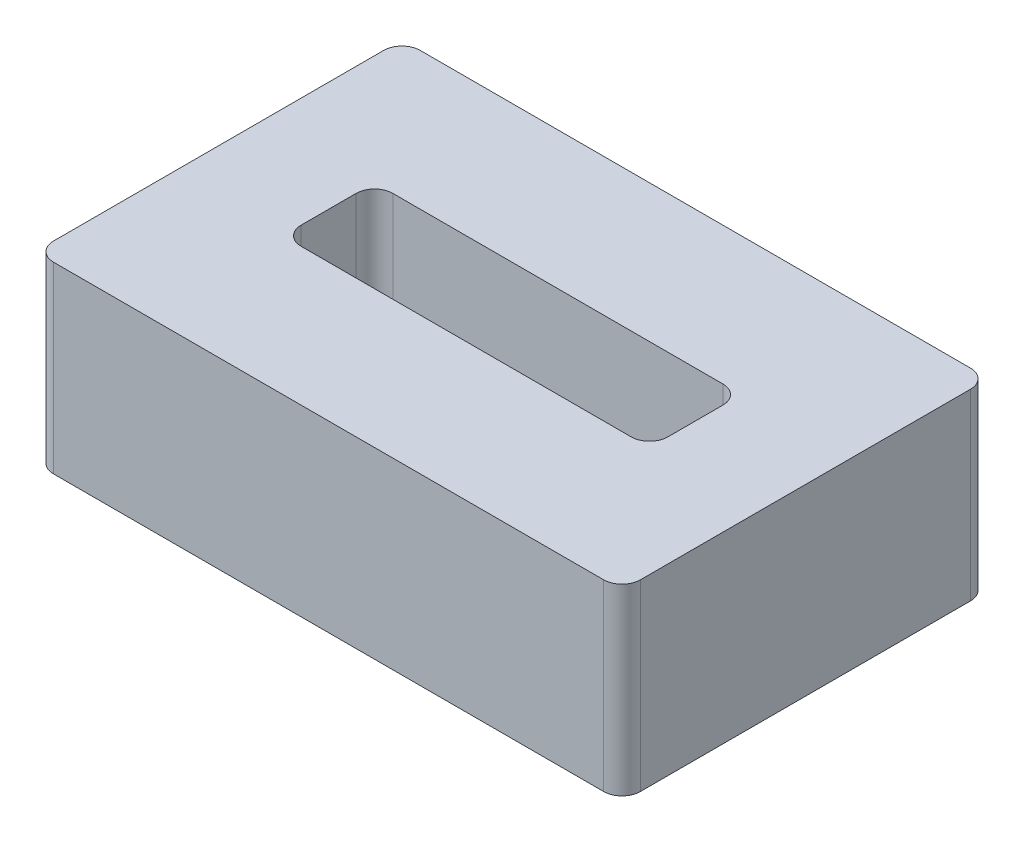
from build123d import *

# Parameters (mm, degrees)
SKETCH1_W           = 16
SKETCH1_H           = 10
SKETCH1_W_2         = 10
SKETCH1_H_2         = 2.5
BOSS_EXTRUDE1_DEPTH = 5
FILLET3_R           = 0.5


with BuildPart() as part:
    # Sketch1 → Boss-Extrude1 (new body)
    with BuildSketch(Plane(origin=(0, 0, 0), x_dir=(1, 0, 0), z_dir=(0, 1, 0))):
        with Locations((8, -5)):
            Rectangle(SKETCH1_W, SKETCH1_H)
        with Locations((8, -5)):
            Rectangle(SKETCH1_W_2, SKETCH1_H_2, mode=Mode.SUBTRACT)
    extrude(amount=BOSS_EXTRUDE1_DEPTH)

    # Fillet3
    fillet3_edges = [part.edges().sort_by_distance(p)[0] for p in [
        (16, 2.5, 0),
        (16, 2.5, 10),
        (0, 2.5, 10),
        (0, 2.5, 0),
        (3, 2.5, 6.25),
        (13, 2.5, 6.25),
        (13, 2.5, 3.75),
        (3, 2.5, 3.75),
    ]]
    fillet(fillet3_edges, radius=FILLET3_R)


solid = part.part
